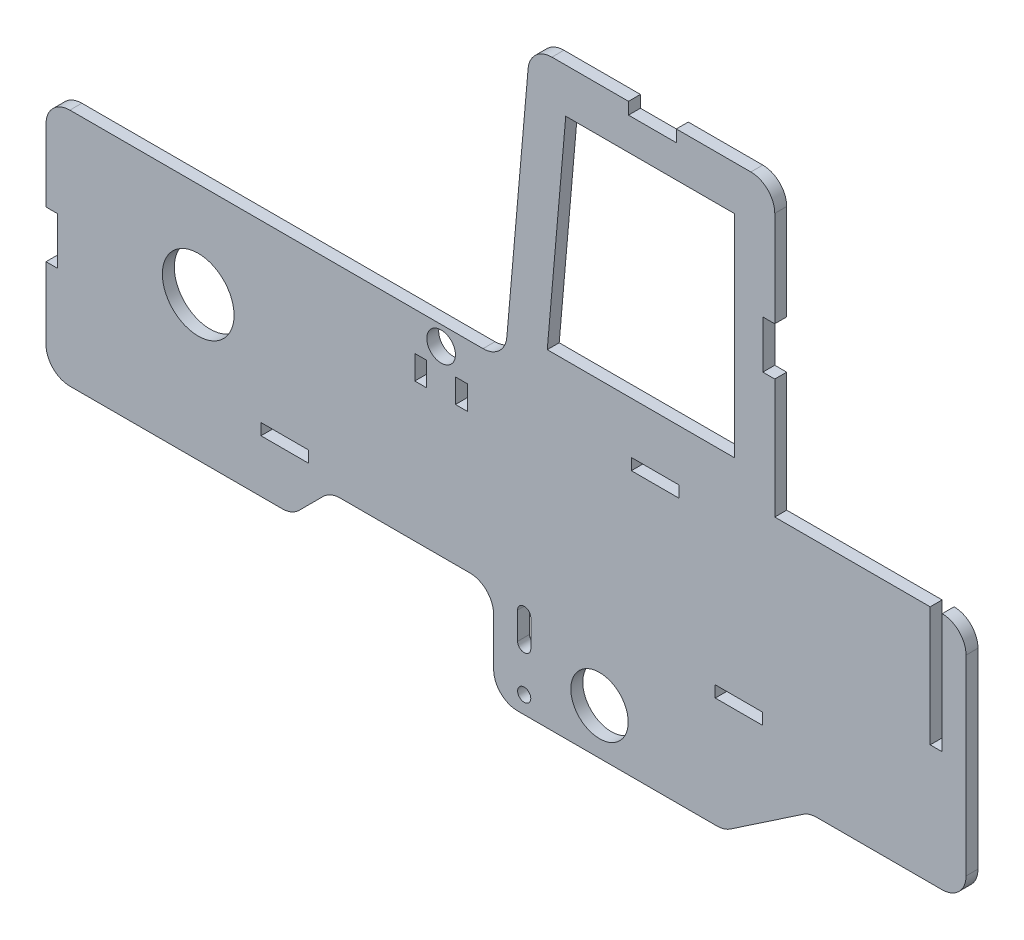
from build123d import *

# Parameters (mm, degrees)
MAIN_SIDE_DEPTH          = 3.175
SKETCH2_W                = 12.573
SKETCH2_H                = 3.048
BOTTOM_PLATE_HOLES_DEPTH = 254.555547868
SKETCH3_W                = 12.7
SKETCH3_H                = 3.048
CUT_EXTRUDE1_DEPTH       = 254.555547868
SKETCH4_W                = 3.048
SKETCH4_H                = 12.573
CUT_EXTRUDE2_DEPTH       = 254.555547868
SKETCH5_W                = 3.175
SKETCH5_H                = 31.75
CUT_EXTRUDE3_DEPTH       = 254.555547868
SKETCH6_R                = 9.525
CUT_EXTRUDE4_DEPTH       = 254.555547868
SKETCH7_W                = 12.7
SKETCH7_H                = 3.175
CUT_EXTRUDE5_DEPTH       = 254.555547868
SKETCH8_W                = 3.175
SKETCH8_H                = 12.7
CUT_EXTRUDE6_DEPTH       = 254.555547868
BOSS_EXTRUDE2_DEPTH      = 3.175
SKETCH10_R               = 1.75
SKETCH10_R_2             = 7.62
CUT_EXTRUDE7_DEPTH       = 254.555547868
FILLET1_R                = 6.35
SKETCH14_R               = 3.81
SKETCH14_W               = 3.175
SKETCH14_H               = 6.35
CUT_EXTRUDE8_DEPTH       = 254.555547868
CUT_EXTRUDE9_DEPTH       = 254.555547868
CUT_EXTRUDE10_DEPTH      = 254.555547868
FILLET2_R                = 6.35


with BuildPart() as part:
    # Sketch1 → Main Side (new body)
    with BuildSketch(Plane.XY):
        Polygon((62.123903317, 7.421650144), (131.966346795, 7.421650144), (147.472889282, 13.771650144), (201.808790274, 13.771650144), (201.808790274, 77.271650144), (151.008790274, 77.271650144), (151.008790274, 153.471650144), (86.008898009, 153.471650144), (79.342261849, 77.271650144), (-42.539209726, 77.271650144), (-42.539209726, 13.771650144), (46.617360741, 13.771650144), align=None)
    extrude(amount=MAIN_SIDE_DEPTH)

    # Sketch2 → Bottom Plate Holes (cut, through all)
    with BuildSketch(Plane.XY.offset(3.175)):
        with Locations((141.483790274, 29.265650144)):
            Rectangle(SKETCH2_W, SKETCH2_H)
        with Locations((20.833790274, 29.265650144)):
            Rectangle(SKETCH2_W, SKETCH2_H)
    extrude(amount=-BOTTOM_PLATE_HOLES_DEPTH, mode=Mode.SUBTRACT)

    # Sketch3 → Cut-Extrude1 (cut, through all)
    with BuildSketch(Plane.XY.offset(3.175)):
        with Locations((119.258790274, 70.413650144)):
            Rectangle(SKETCH3_W, SKETCH3_H)
    extrude(amount=-CUT_EXTRUDE1_DEPTH, mode=Mode.SUBTRACT)

    # Sketch4 → Cut-Extrude2 (cut, through all)
    with BuildSketch(Plane.XY.offset(3.175)):
        with Locations((-41.015209726, 45.521650144)):
            Rectangle(SKETCH4_W, SKETCH4_H)
    extrude(amount=-CUT_EXTRUDE2_DEPTH, mode=Mode.SUBTRACT)

    # Sketch5 → Cut-Extrude3 (cut, through all)
    with BuildSketch(Plane.XY.offset(3.175)):
        with Locations((193.871290274, 61.396650144)):
            Rectangle(SKETCH5_W, SKETCH5_H)
    extrude(amount=-CUT_EXTRUDE3_DEPTH, mode=Mode.SUBTRACT)

    # Sketch6 → Cut-Extrude4 (cut, through all)
    with BuildSketch(Plane.XY.offset(3.175)):
        with Locations((-2.114209726, 51.856650144)):
            Circle(SKETCH6_R)
    extrude(amount=-CUT_EXTRUDE4_DEPTH, mode=Mode.SUBTRACT)

    # Sketch7 → Cut-Extrude5 (cut, through all)
    with BuildSketch(Plane.XY.offset(3.175)):
        with Locations((118.508844141, 151.884150144)):
            Rectangle(SKETCH7_W, SKETCH7_H)
    extrude(amount=-CUT_EXTRUDE5_DEPTH, mode=Mode.SUBTRACT)

    # Sketch8 → Cut-Extrude6 (cut, through all)
    with BuildSketch(Plane.XY.offset(3.175)):
        with Locations((149.421290274, 115.371650144)):
            Rectangle(SKETCH8_W, SKETCH8_H)
    extrude(amount=-CUT_EXTRUDE6_DEPTH, mode=Mode.SUBTRACT)

    # Sketch13 → Boss-Extrude2 (add)
    with BuildSketch(Plane.XY.offset(3.175)):
        Polygon((33.917360741, 13.771650144), (56.482594802, -1.468349856), (137.607655293, -1.468349856), (160.172889282, 13.771650144), (147.472889282, 13.771650144), (131.966346795, 7.421650144), (62.123903317, 7.421650144), (46.617360741, 13.771650144), align=None)
    extrude(amount=-BOSS_EXTRUDE2_DEPTH)

    # Sketch10 → Cut-Extrude7 (cut, through all)
    with BuildSketch(Plane.XY.offset(3.175)):
        with Locations((84.460790274, 3.141650144)):
            Circle(SKETCH10_R)
        with Locations((104.460790274, 10.641650144)):
            Circle(SKETCH10_R_2)
        with BuildLine():
            Line((86.210790274, 21.734048116), (86.210790274, 14.549252171))
            ThreePointArc((86.210790274, 14.549252171), (84.460790274, 12.799252171), (82.710790274, 14.549252171))
            Line((82.710790274, 14.549252171), (82.710790274, 21.734048116))
            ThreePointArc((82.710790274, 21.734048116), (84.460790274, 23.484048116), (86.210790274, 21.734048116))
        make_face()
    extrude(amount=-CUT_EXTRUDE7_DEPTH, mode=Mode.SUBTRACT)

    # Fillet1
    fillet1_edges = [part.edges().sort_by_distance(p)[0] for p in [
        (33.917360741, 13.771650144, 1.5875),
        (160.172889282, 13.771650144, 1.5875),
        (137.607655293, -1.468349856, 1.5875),
        (56.482594802, -1.468349856, 1.5875),
        (-42.539209726, 13.771650144, 1.5875),
        (-42.539209726, 77.271650144, 1.5875),
        (79.342261849, 77.271650144, 1.5875),
        (86.008898009, 153.471650144, 1.5875),
        (151.008790274, 153.471650144, 1.5875),
        (201.808790274, 77.271650144, 1.5875),
        (201.808790274, 13.771650144, 1.5875),
    ]]
    fillet(fillet1_edges, radius=FILLET1_R - 0.0001)  # a hair under: the kernel refuses the full size

    # Sketch14 → Cut-Extrude8 (cut, through all)
    with BuildSketch(Plane.XY.offset(3.175)):
        with Locations((62.390480298, 6.151650144)):
            Circle(SKETCH14_R)
        with Locations((62.390480298, 72.191650144)):
            Circle(SKETCH14_R)
        with Locations((56.992980298, 63.936650144)):
            Rectangle(SKETCH14_W, SKETCH14_H)
        with Locations((67.787980298, 63.936650144)):
            Rectangle(SKETCH14_W, SKETCH14_H)
        with Locations((67.787980298, 14.406650144)):
            Rectangle(SKETCH14_W, SKETCH14_H)
        with Locations((56.992980298, 14.406650144)):
            Rectangle(SKETCH14_W, SKETCH14_H)
    extrude(amount=-CUT_EXTRUDE8_DEPTH, mode=Mode.SUBTRACT)

    # Sketch15 → Cut-Extrude9 (cut, through all)
    with BuildSketch(Plane.XY.offset(3.175)):
        Polygon((90.585226868, 85.563055457), (95.498090229, 141.717340628), (140.342125594, 141.717340628), (140.342125594, 85.563055457), align=None)
    extrude(amount=-CUT_EXTRUDE9_DEPTH, mode=Mode.SUBTRACT)

    # Sketch16 → Cut-Extrude10 (cut, through all)
    with BuildSketch(Plane.XY.offset(3.175)):
        Polygon((32.963134486, 23.931650144), (76.348530262, 23.931650144), (76.348530262, -1.468349856), (32.963134486, -1.468349856), (32.963134486, 12.534188724), (21.565673066, 12.534188724), align=None)
    extrude(amount=-CUT_EXTRUDE10_DEPTH, mode=Mode.SUBTRACT)

    # Fillet2
    fillet2_edges = [part.edges().sort_by_distance(p)[0] for p in [
        (22.803134486, 13.771650144, 1.5875),
        (76.348530262, -1.468349856, 1.5875),
        (32.963134486, 23.931650144, 1.5875),
        (76.348530262, 23.931650144, 1.5875),
    ]]
    fillet(fillet2_edges, radius=FILLET2_R)


solid = part.part
